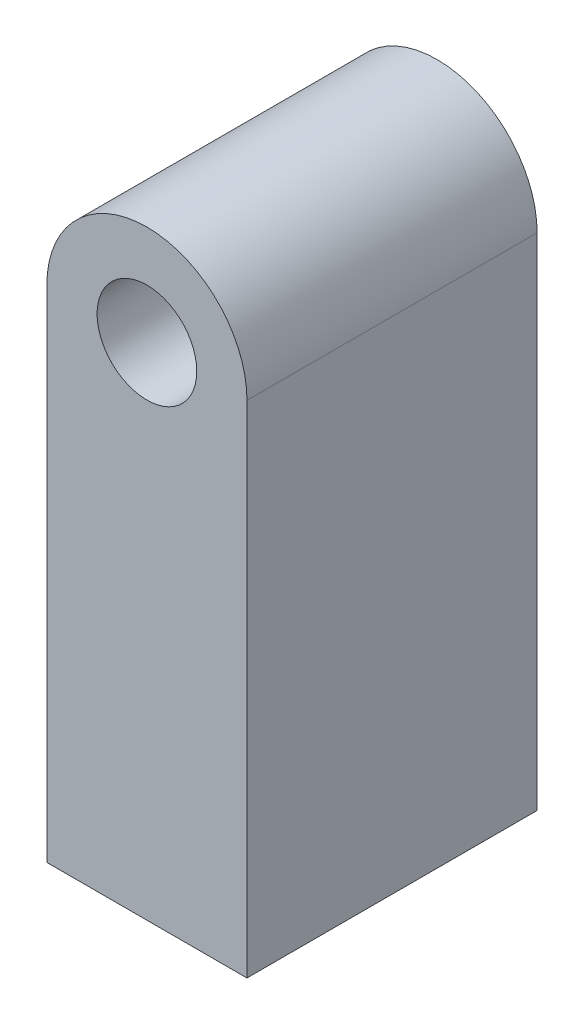
from build123d import *

# Parameters (mm, degrees)
BOSS_EXTRUDE1_DEPTH         = 9.2075
F_1_4_0_249_DOWEL_HOLE1_D   = 6.3246
F_1_4_20_TAPPED_HOLE1_D     = 5.1054
F_1_4_20_TAPPED_HOLE1_DEPTH = 13.335
F_1_4_20_TAPPED_HOLE1_TIP   = 1.533816902


with BuildPart() as part:
    # Sketch2 → Boss-Extrude1 (new, symmetric)
    with BuildSketch(Plane.XY):
        with BuildLine():
            Line((-6.35, 0), (6.35, 0))
            Line((6.35, 0), (6.35, 31.75))
            ThreePointArc((6.35, 31.75), (0, 38.1), (-6.35, 31.75))
            Line((-6.35, 31.75), (-6.35, 0))
        make_face()
    extrude(amount=BOSS_EXTRUDE1_DEPTH, both=True)

    # 1/4 (0.249) Dowel Hole1 (through all)
    with Locations(Plane.XY.offset(9.2075)):
        with Locations((0, 31.75)):
            Hole(F_1_4_0_249_DOWEL_HOLE1_D / 2)

    # 1/4-20 Tapped Hole1
    with Locations(Plane(origin=(0, 0, 0), x_dir=(-1, 0, 0), z_dir=(0, -1, 0))):
        with Locations((0, 0)):
            Hole(F_1_4_20_TAPPED_HOLE1_D / 2, depth=F_1_4_20_TAPPED_HOLE1_DEPTH)
            with Locations((0, 0, -(F_1_4_20_TAPPED_HOLE1_DEPTH + F_1_4_20_TAPPED_HOLE1_TIP / 2))):  # 118° drill point
                Cone(0, F_1_4_20_TAPPED_HOLE1_D / 2, F_1_4_20_TAPPED_HOLE1_TIP, mode=Mode.SUBTRACT)


solid = part.part
